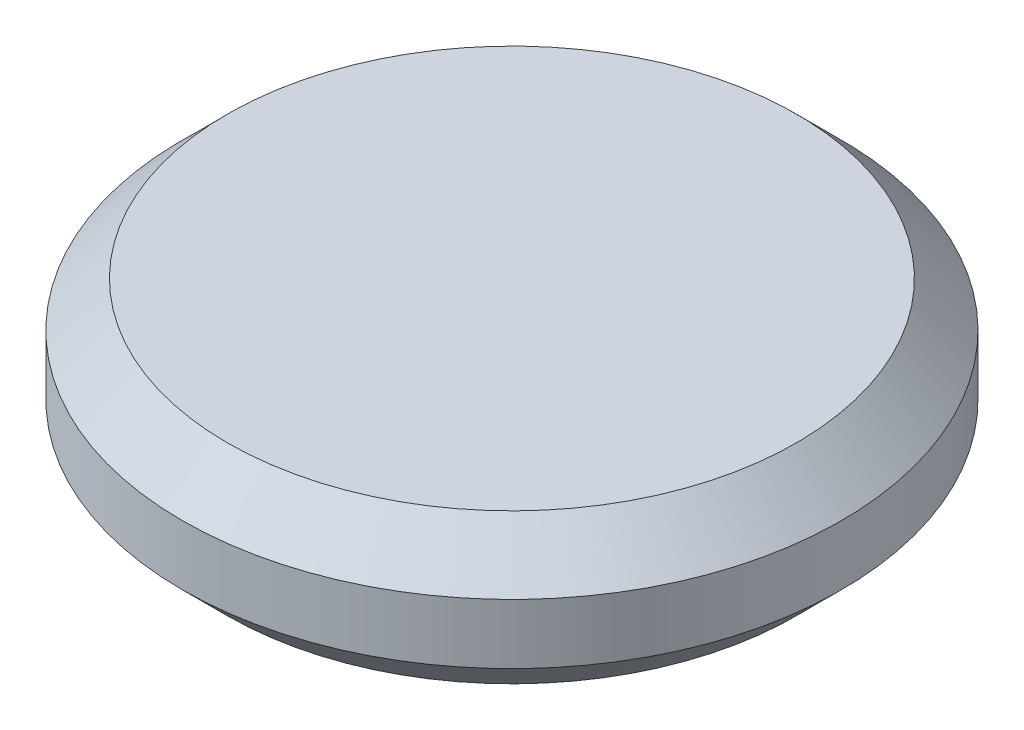
from build123d import *

# Parameters (mm, degrees)
SKETCH2_R           = 110
BOSS_EXTRUDE1_DEPTH = 50
CHAMFER1_SIZE       = 15
SCALE1_SCALE        = 0.333333333


with BuildPart() as part:
    # Sketch2 → Boss-Extrude1 (new body)
    with BuildSketch(Plane(origin=(0, 0, 0), x_dir=(1, 0, 0), z_dir=(0, 1, 0))):
        Circle(SKETCH2_R)
    extrude(amount=BOSS_EXTRUDE1_DEPTH)

    # Chamfer1
    chamfer1_edges = [part.edges().sort_by_distance(p)[0] for p in [
        (-110, 0, 0),
        (-110, 50, 0),
    ]]
    chamfer(chamfer1_edges, length=CHAMFER1_SIZE)


with BuildPart() as part_1:
    # Scale1: scaled about (0, 0, 0)
    add(part.part.scale(SCALE1_SCALE))


solid = part_1.part
